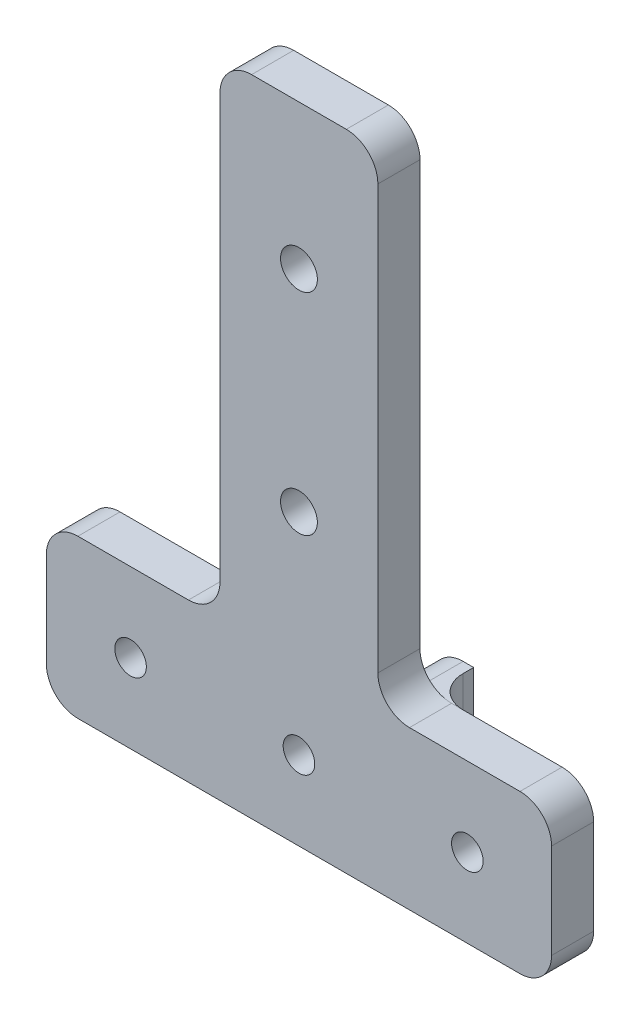
from build123d import *

# Parameters (mm, degrees)
SKETCH_1_R      = 1.75
SKETCH_1_R_2    = 1.5
EXTRUDE_1_DEPTH = 4
FILLET_1_R      = 3
EXTRUDE_2_DEPTH = 4
FILLET_2_R      = 3
FILLET_3_R      = 3


with BuildPart() as part:
    # 草图1 → 凸台-拉伸1 (new body)
    with BuildSketch(Plane.XY):
        Polygon((-7.5, 7.5), (-7.5, 53.732798972), (7.5, 53.732798972), (7.5, 7.5), (24, 7.5), (24, -7.5), (-24, -7.5), (-24, 7.5), align=None)
        with Locations((0, 40)):
            Circle(SKETCH_1_R, mode=Mode.SUBTRACT)
        with Locations((0, 20)):
            Circle(SKETCH_1_R, mode=Mode.SUBTRACT)
        with Locations((16, 0)):
            Circle(SKETCH_1_R_2, mode=Mode.SUBTRACT)
        Circle(SKETCH_1_R_2, mode=Mode.SUBTRACT)
        with Locations((-16, 0)):
            Circle(SKETCH_1_R_2, mode=Mode.SUBTRACT)
    extrude(amount=EXTRUDE_1_DEPTH)

    # 圆角1
    fillet_1_edges = [part.edges().sort_by_distance(p)[0] for p in [
        (-7.5, 53.732798972, 2),
        (7.5, 53.732798972, 2),
        (7.5, 7.5, 2),
        (24, 7.5, 2),
        (24, -7.5, 2),
        (-24, -7.5, 2),
        (-24, 7.5, 2),
        (-7.5, 7.5, 2),
    ]]
    fillet(fillet_1_edges, radius=FILLET_1_R)

    # 草图2 → 凸台-拉伸2 (add)
    with BuildSketch(Plane(origin=(0, 0, 0), x_dir=(-1, 0, 0), z_dir=(0, 0, -1))):
        Polygon((4.6, -4.836204333), (4.6, -7.5), (8.6, -7.5), (8.6, 7.5), (4.6, 7.5), align=None)
        Polygon((-4.6, -4.836204333), (-4.6, 7.5), (-8.6, 7.5), (-8.6, -7.5), (-4.6, -7.5), align=None)
    extrude(amount=EXTRUDE_2_DEPTH)

    # 圆角2
    # the kernel refuses this fillet: 3 mm, written as the material it adds along each edge
    with BuildSketch(Plane(origin=(-8.6, -7.5, 0), x_dir=(-1, 0, 0), z_dir=(0, 1, 0)), Plane(origin=(8.6, 7.5, 0), x_dir=(1, 0, 0), z_dir=(0, -1, 0))) as fillet_2_piece_1:
        with BuildLine():
            CenterArc((FILLET_2_R, -FILLET_2_R), FILLET_2_R, 90, 90)
            Line((0, -FILLET_2_R), (0, 0))
            Line((0, 0), (FILLET_2_R, 0))
        make_face()
    extrude(amount=15)

    # 圆角3
    fillet_3_edges = [part.edges().sort_by_distance(p)[0] for p in [
        (-4.6, 7.5, -2),
        (4.6, 7.5, -2),
    ]]
    fillet(fillet_3_edges, radius=FILLET_3_R)


solid = part.part
